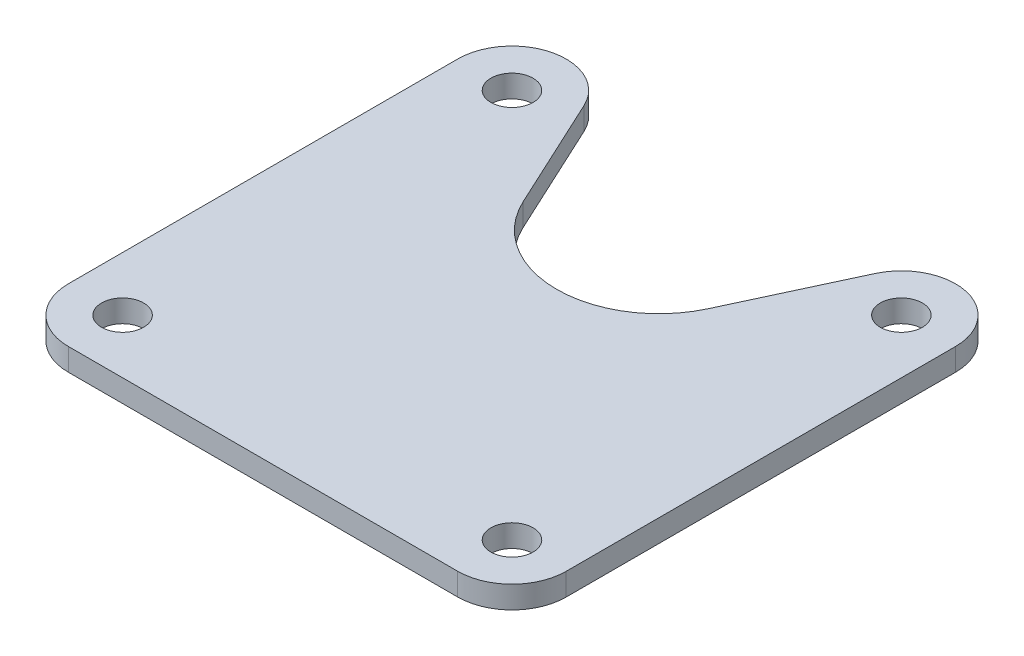
from build123d import *

# Parameters (mm, degrees)
SKETCH1_W        = 39
SKETCH1_H        = 39
SKETCH1_R        = 1.65
SHAPE_DEPTH      = 1.75
CAMERA_CUT_REACH = 29.633


with BuildPart() as part:
    # Sketch1 → Shape (new body)
    with BuildSketch(Plane(origin=(0, 0, 0), x_dir=(1, 0, 0), z_dir=(0, 1, 0))):
        Rectangle(SKETCH1_W, SKETCH1_H)
        with Locations((-15.25, 15.25)):
            Circle(SKETCH1_R, mode=Mode.SUBTRACT)
        with Locations((15.25, 15.25)):
            Circle(SKETCH1_R, mode=Mode.SUBTRACT)
        with Locations((-15.25, -15.25)):
            Circle(SKETCH1_R, mode=Mode.SUBTRACT)
        with Locations((15.25, -15.25)):
            Circle(SKETCH1_R, mode=Mode.SUBTRACT)
    extrude(amount=SHAPE_DEPTH)

    # Sketch2 → Camera cut (cut, up to next)
    with BuildSketch(Plane(origin=(0, 1.75, 0), x_dir=(1, 0, 0), z_dir=(0, 1, 0)), mode=Mode.PRIVATE) as camera_cut_sk1:
        with BuildLine():
            ThreePointArc((-7.255139017, 8.12910133), (0, 3.5), (7.255139017, 8.12910133))
            Line((7.255139017, 8.12910133), (11.395707531, 17.040790207))
            ThreePointArc((11.395707531, 17.040790207), (12.963994574, 18.83283117), (15.25, 19.5))
            Line((15.25, 19.5), (-15.249999971, 19.5))
            ThreePointArc((-15.249999971, 19.5), (-12.963994499, 18.832831122), (-11.395707469, 17.040790074))
            Line((-11.395707469, 17.040790074), (-7.255139017, 8.12910133))
        make_face()
    camera_cut_tool1 = extrude(camera_cut_sk1.sketch, amount=-CAMERA_CUT_REACH, mode=Mode.PRIVATE) & part.part
    # Sketch2 → Camera cut (cut, up to next)
    with BuildSketch(Plane(origin=(0, 1.75, 0), x_dir=(1, 0, 0), z_dir=(0, 1, 0)), mode=Mode.PRIVATE) as camera_cut_sk2:
        with BuildLine():
            ThreePointArc((-19.5, 15.25), (-18.25520381, 18.25520383), (-15.249999971, 19.5))
            Line((-15.249999971, 19.5), (-19.5, 19.5))
            Line((-19.5, 19.5), (-19.5, 15.25))
        make_face()
    camera_cut_tool2 = extrude(camera_cut_sk2.sketch, amount=-CAMERA_CUT_REACH, mode=Mode.PRIVATE) & part.part
    # Sketch2 → Camera cut (cut, up to next)
    with BuildSketch(Plane(origin=(0, 1.75, 0), x_dir=(1, 0, 0), z_dir=(0, 1, 0)), mode=Mode.PRIVATE) as camera_cut_sk3:
        with BuildLine():
            Line((19.5, 19.5), (15.25, 19.5))
            ThreePointArc((15.25, 19.5), (18.25520382, 18.25520382), (19.5, 15.25))
            Line((19.5, 15.25), (19.5, 19.5))
        make_face()
    camera_cut_tool3 = extrude(camera_cut_sk3.sketch, amount=-CAMERA_CUT_REACH, mode=Mode.PRIVATE) & part.part
    # Sketch2 → Camera cut (cut, up to next)
    with BuildSketch(Plane(origin=(0, 1.75, 0), x_dir=(1, 0, 0), z_dir=(0, 1, 0)), mode=Mode.PRIVATE) as camera_cut_sk4:
        with BuildLine():
            ThreePointArc((-15.25, -19.5), (-18.255203845, -18.255203795), (-19.5, -15.249999928))
            Line((-19.5, -15.249999928), (-19.5, -19.5))
            Line((-19.5, -19.5), (-15.25, -19.5))
        make_face()
    camera_cut_tool4 = extrude(camera_cut_sk4.sketch, amount=-CAMERA_CUT_REACH, mode=Mode.PRIVATE) & part.part
    # Sketch2 → Camera cut (cut, up to next)
    with BuildSketch(Plane(origin=(0, 1.75, 0), x_dir=(1, 0, 0), z_dir=(0, 1, 0)), mode=Mode.PRIVATE) as camera_cut_sk5:
        with BuildLine():
            Line((19.5, -19.5), (19.5, -15.25))
            ThreePointArc((19.5, -15.25), (18.255203817, -18.255203823), (15.249999992, -19.5))
            Line((15.249999992, -19.5), (19.5, -19.5))
        make_face()
    camera_cut_tool5 = extrude(camera_cut_sk5.sketch, amount=-CAMERA_CUT_REACH, mode=Mode.PRIVATE) & part.part
    add(camera_cut_tool1.solids().sort_by_distance((0, 1.75, -12.946988))[0], mode=Mode.SUBTRACT)
    add(camera_cut_tool2.solids().sort_by_distance((-18.550686, 1.75, -18.550686))[0], mode=Mode.SUBTRACT)
    add(camera_cut_tool3.solids().sort_by_distance((18.550686, 1.75, -18.550686))[0], mode=Mode.SUBTRACT)
    add(camera_cut_tool4.solids().sort_by_distance((-18.550686, 1.75, 18.550686))[0], mode=Mode.SUBTRACT)
    add(camera_cut_tool5.solids().sort_by_distance((18.550686, 1.75, 18.550686))[0], mode=Mode.SUBTRACT)


solid = part.part
